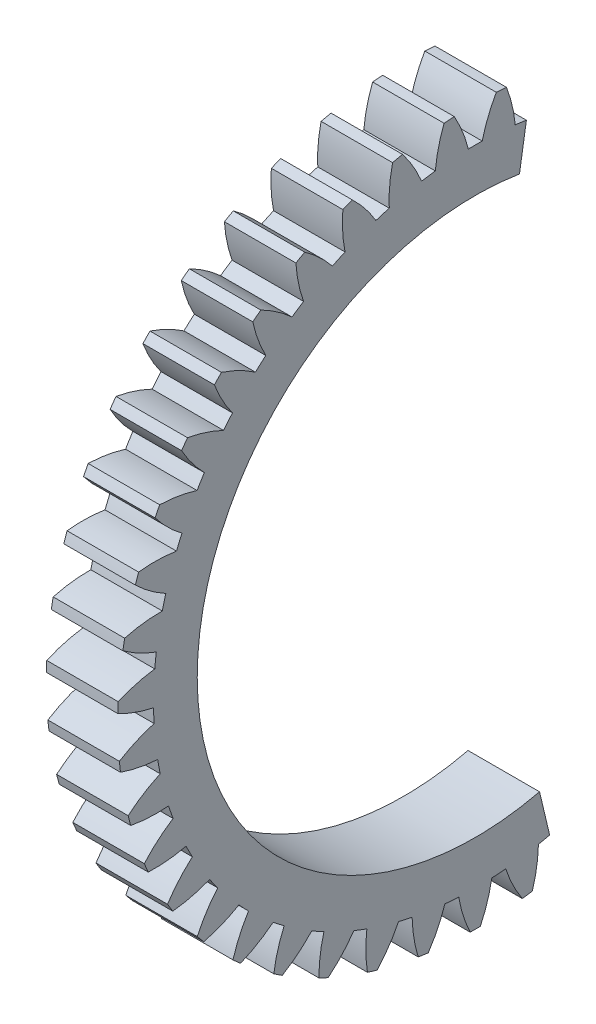
from build123d import *

# Parameters (mm, degrees)
BASPROSKE_W                = 9
BASPROSKE_H                = 45
TOOTHCUT_DEPTH             = 65.272855857
TEETHCUTS_COUNT            = 43
TEETHCUTS_ANGLE            = 351.627906977
BORSKE_R                   = 35
BORE_DEPTH                 = 50.0006604
WYTNIJ_WYCI_GNI_CIE2_DEPTH = 65.265003825


with BuildPart() as part:
    # BasProSke → Base-Revolve (revolve)
    with BuildSketch(Plane(origin=(0, 0, 0), x_dir=(1, 0, 0), z_dir=(0, 1, 0))):
        with Locations((4.5, 22.5)):
            Rectangle(BASPROSKE_W, BASPROSKE_H)
    revolve(axis=Axis((-10, 0, 0), (1, 0, 0)))

    # TooCutSke → ToothCut (cut, through all)
    with BuildSketch(Plane(origin=(0, 0, 0), x_dir=(0, 0, -1), z_dir=(1, 0, 0))):
        with BuildLine():
            ThreePointArc((0.875138877, 40.489543501), (0, 40.499), (-0.875138877, 40.489543501))
            ThreePointArc((-0.875138877, 40.489543501), (-1.611840844, 42.780747503), (-2.66114443, 44.94669015))
            ThreePointArc((-2.66114443, 44.94669015), (0, 45.0254), (2.66114443, 44.94669015))
            ThreePointArc((2.66114443, 44.94669015), (1.611840844, 42.780747503), (0.875138877, 40.489543501))
        make_face()
    toothcut = extrude(amount=TOOTHCUT_DEPTH, mode=Mode.SUBTRACT)

    # TeethCuts: ToothCut ×43 about axis
    teethcuts_axis = Axis((-10, 0, 0), (1, 0, 0))
    for i in range(1, TEETHCUTS_COUNT):
        add(toothcut.rotate(teethcuts_axis, i * TEETHCUTS_ANGLE / (TEETHCUTS_COUNT - 1)), mode=Mode.SUBTRACT)

    # BorSke → Bore (cut, symmetric)
    with BuildSketch(Plane(origin=(0, 0, 0), x_dir=(0, 0, -1), z_dir=(1, 0, 0))):
        Circle(BORSKE_R)
    extrude(amount=BORE_DEPTH, both=True, mode=Mode.SUBTRACT)

    # Szkic2 → Wytnij-wyciągnięcie2 (cut, through all)
    with BuildSketch(Plane(origin=(0, 0, 0), x_dir=(0, 0, -1), z_dir=(1, 0, 0))):
        Polygon((4.641350643, 28.827807813), (6.249446703, -26.30622421), (10.919986137, -45.966245864), (68.2286098, -47.979903604), (54.053229084, 56.074326501), (14.554160093, 57.462208479), (7.470376125, 46.399116076), align=None)
    extrude(amount=WYTNIJ_WYCI_GNI_CIE2_DEPTH, mode=Mode.SUBTRACT)


solid = part.part
